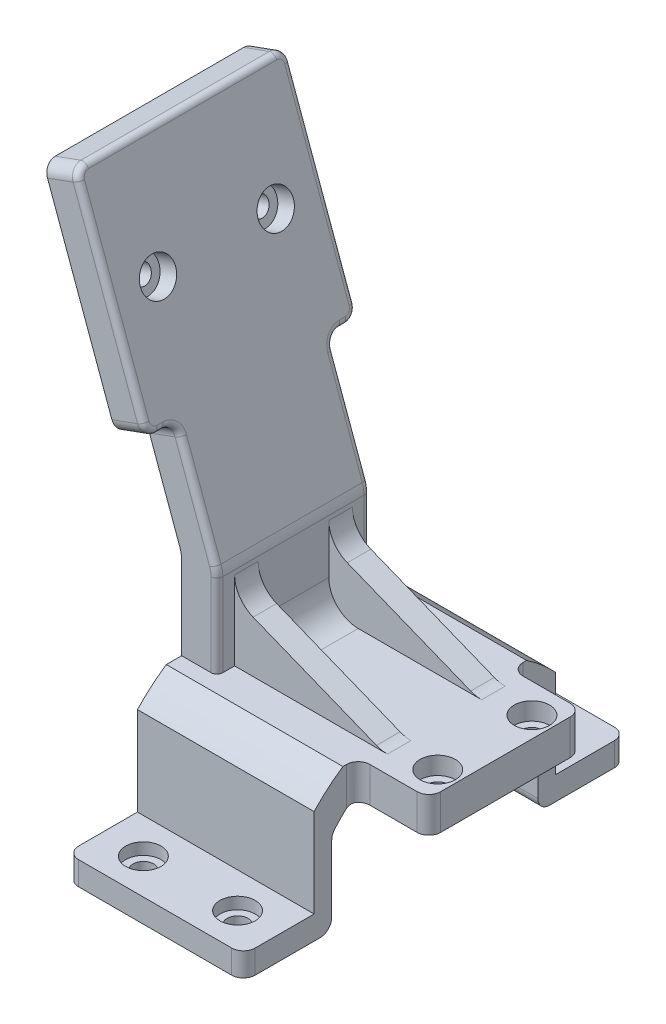
from build123d import *

# Parameters (mm, degrees)
SKETCH_1_W              = 42
SKETCH_1_H              = 26
SKETCH_1_R              = 1.7
EXTRUDE_1_DEPTH         = 6
SKETCH_15_W             = 6
SKETCH_15_H             = 26
EXTRUDE_4_DEPTH         = 15
EXTRUDE_5_DEPTH         = 26
SKETCH_17_W             = 36
SKETCH_17_H             = 36
SKETCH_17_R             = 1.6
EXTRUDE_6_DEPTH         = 5.638155725
FILLET_3_R              = 2
SKETCH_18_R             = 3
CUT_EXTRUDE_4_DEPTH     = 3
SKETCH_19_R             = 3
CUT_EXTRUDE_5_DEPTH     = 3
FILLET_4_R              = 1
FILLET_6_R              = 5
EXTRUDE_7_DEPTH         = 2
FILLET_7_R              = 5
FILLET_8_R              = 5
SKETCH_21_W             = 30
SKETCH_21_H             = 7.5
EXTRUDE_8_DEPTH         = 6
SKETCH_23_W             = 30
SKETCH_23_H             = 3
EXTRUDE_9_DEPTH         = 17.25
SKETCH_24_W             = 30
SKETCH_24_H             = 4
EXTRUDE_10_DEPTH        = 12
EXTRUDE_11_DEPTH        = 30
FILLET_9_R              = 2
CUT_EXTRUDE_6_DEPTH     = 38
FILLET_11_R             = 2
SKETCH_29_R             = 1.75
CUT_EXTRUDE_7_DEPTH     = 38
SKETCH_30_R             = 3
CUT_EXTRUDE_8_DEPTH     = 2
FILLET_9_OF_MIRROR_2_R  = 2
FILLET_11_OF_MIRROR_2_R = 2
FILLET_14_R             = 2


with BuildPart() as part:
    # 草图1 → 凸台-拉伸1 (new body)
    with BuildSketch(Plane(origin=(0, 0, 0), x_dir=(1, 0, 0), z_dir=(0, 1, 0))):
        Rectangle(SKETCH_1_W, SKETCH_1_H)
        with Locations(Location((17.5, 8, 0), (0, 0, 270))):
            Circle(SKETCH_1_R, mode=Mode.SUBTRACT)
        with Locations(Location((17.5, -8, 0), (0, 0, 90))):
            Circle(SKETCH_1_R, mode=Mode.SUBTRACT)
    extrude(amount=EXTRUDE_1_DEPTH)

    # 草图15 → 凸台-拉伸4 (add)
    with BuildSketch(Plane(origin=(0, 6, 0), x_dir=(1, 0, 0), z_dir=(0, 1, 0))):
        with Locations((-18, 0)):
            Rectangle(SKETCH_15_W, SKETCH_15_H)
    extrude(amount=EXTRUDE_4_DEPTH)

    # 草图16 → 凸台-拉伸5 (add)
    with BuildSketch(Plane.XY.offset(13)):
        Polygon((-15, 21), (-21.858229251, 39.842830003), (-27.15636258, 37.914467174), (-21, 21), align=None)
    extrude(amount=-EXTRUDE_5_DEPTH)

    # 草图17 → 凸台-拉伸6 (add)
    with BuildSketch(Plane(origin=(-11.794196751, -4.292736554, 0), x_dir=(0, 0, 1), z_dir=(-0.9396926207859104, -0.3420201433256632, 0))):
        with Locations((0, 62.915968046)):
            Rectangle(SKETCH_17_W, SKETCH_17_H)
        with Locations(Location((10, 62.915968046, 0), (0, 0, 270))):
            Circle(SKETCH_17_R, mode=Mode.SUBTRACT)
        with Locations(Location((-10, 62.915968046, 0), (0, 0, 90))):
            Circle(SKETCH_17_R, mode=Mode.SUBTRACT)
    extrude(amount=-EXTRUDE_6_DEPTH)

    # 圆角3
    fillet_3_edges = [part.edges().sort_by_distance(p)[0] for p in [
        (-24.507295915, 38.878648589, 13),
        (-24.507295915, 38.878648589, -13),
        (-24.507295915, 38.878648589, 18),
        (-36.820021075, 72.707582937, 18),
        (-24.507295915, 38.878648589, -18),
        (-36.820021075, 72.707582937, -18),
    ]]
    fillet(fillet_3_edges, radius=FILLET_3_R)

    # 草图18 → 切除-拉伸4 (cut)
    with BuildSketch(Plane(origin=(-6.496063422, -2.364373725, 0), x_dir=(0, 0, -1), z_dir=(0.9396926207859105, 0.34202014332566305, 0))):
        with Locations(Location((-10, 62.915968046, 0), (0, 0, 90))):
            Circle(SKETCH_18_R)
        with Locations(Location((10, 62.915968046, 0), (0, 0, 90))):
            Circle(SKETCH_18_R)
    extrude(amount=-CUT_EXTRUDE_4_DEPTH, mode=Mode.SUBTRACT)

    # 草图19 → 切除-拉伸5 (cut)
    with BuildSketch(Plane(origin=(0, 6, 0), x_dir=(1, 0, 0), z_dir=(0, 1, 0))):
        with Locations(Location((17.5, 8, 0), (0, 0, 270))):
            Circle(SKETCH_19_R)
        with Locations(Location((17.5, -8, 0), (0, 0, 270))):
            Circle(SKETCH_19_R)
    extrude(amount=-CUT_EXTRUDE_5_DEPTH, mode=Mode.SUBTRACT)

    # 圆角4
    fillet_4_edges = [part.edges().sort_by_distance(p)[0] for p in [
        (-15, 13.5, 13),
        (-15, 13.5, -13),
        (-18.087094482, 29.481722381, 13),
        (-18.087094482, 29.481722381, -13),
        (-21.85822925, 39.842830003, -15.5),
        (-21.85822925, 39.842830003, 15.5),
        (-28.01459183, 56.757297177, 18),
        (-34.17095441, 73.671764352, 0),
        (-28.01459183, 56.757297177, -18),
        (-33.970603649, 73.121305159, -17.414213562),
        (-22.058580012, 40.393289196, -17.414213562),
        (-22.058580012, 40.393289196, 17.414213562),
        (-33.970603649, 73.121305159, 17.414213562),
        (-21.657878489, 39.292370811, -13.585786438),
        (-21.657878489, 39.292370811, 13.585786438),
    ]]
    fillet(fillet_4_edges, radius=FILLET_4_R)

    # 圆角6
    # the kernel refuses this fillet: 5 mm, written as the material it adds along each edge
    with BuildSketch(Plane(origin=(-21, 21, 13), x_dir=(0, -1, 0), z_dir=(0, 0, -1))) as fillet_6_piece_1:
        with BuildLine():
            CenterArc((FILLET_6_R * 0.176326980708, FILLET_6_R), FILLET_6_R, 250, 20)
            Line((-FILLET_6_R * 0.165693162617, FILLET_6_R * 0.0603073792141), (0, 0))
            Line((0, 0), (FILLET_6_R * 0.176326980708, 0))
        make_face()
    extrude(amount=26)
    # the kernel refuses this fillet: 5 mm, written as the material it takes off along each edge
    with BuildSketch(Plane(origin=(-20, 20.118365097, -13), x_dir=(0.9396926207859104, 0.3420201433256632, 0), z_dir=(-0.3420201433256632, 0.9396926207859104, 0))) as fillet_6_2_piece_1:
        with BuildLine():
            CenterArc((4, -1), 1, 0, 90)
            Line((5, -1), (5, 0))
            Line((5, 0), (4, 0))
        make_face()
    revolve(axis=Axis((-20, 20.118365097, -13), (0, 0, -1)), revolution_arc=20, mode=Mode.SUBTRACT)
    with BuildSketch(Plane(origin=(-20, 20.118365097, 13), x_dir=(1, 0, 0), z_dir=(0, -1, 0))) as fillet_6_2_piece_2:
        with BuildLine():
            CenterArc((4, -1), 1, 0, 90)
            Line((5, -1), (5, 0))
            Line((5, 0), (4, 0))
        make_face()
    revolve(axis=Axis((-20, 20.118365097, 13), (0, 0, 1)), revolution_arc=20, mode=Mode.SUBTRACT)
    with BuildSketch(Plane(origin=(-15, 21.000000001, -13), x_dir=(-0.34202014332566494, 0.9396926207859098, 0), z_dir=(0, 0, 1))) as fillet_6_2_piece_3:
        with BuildLine():
            CenterArc((FILLET_6_R * 0.176326980708, FILLET_6_R), FILLET_6_R, 250, 20)
            Line((-FILLET_6_R * 0.165693162617, FILLET_6_R * 0.0603073792141), (0, 0))
            Line((0, 0), (FILLET_6_R * 0.176326980708, 0))
        make_face()
    extrude(amount=26, mode=Mode.SUBTRACT)

    # 草图20 → 凸台-拉伸7 (add, symmetric)
    with BuildSketch(Plane.XY.offset(8)):
        Polygon((-15, 16), (10, 6), (-15, 6), align=None)
    extrude_7 = extrude(amount=EXTRUDE_7_DEPTH, both=True)

    # 镜向1: 凸台-拉伸7 across plane
    add(extrude_7.mirror(Plane(origin=(0, 0, 0), x_dir=(1, 0, 0), z_dir=(0, 0, -1))))

    # 圆角7
    fillet_7_edges = [part.edges().sort_by_distance(p)[0] for p in [
        (-15, 16, 8),
        (10, 6, 8),
        (-15, 16, -8),
        (10, 6, -8),
    ]]
    fillet(fillet_7_edges, radius=FILLET_7_R)

    # 圆角8
    fillet_8_edges = [part.edges().sort_by_distance(p)[0] for p in [
        (-15, 6, 0),
    ]]
    fillet(fillet_8_edges, radius=FILLET_8_R)

    # 草图21 → 凸台-拉伸8 (add)
    with BuildSketch(Plane(origin=(0, 6, 0), x_dir=(1, 0, 0), z_dir=(0, 1, 0))):
        with Locations((-6, -16.75)):
            Rectangle(SKETCH_21_W, SKETCH_21_H)
    extrude_8 = extrude(amount=-EXTRUDE_8_DEPTH)

    # 草图23 → 凸台-拉伸9 (add)
    with BuildSketch(Plane.XZ):
        with Locations((-6, 19)):
            Rectangle(SKETCH_23_W, SKETCH_23_H)
    extrude_9 = extrude(amount=EXTRUDE_9_DEPTH)

    # 草图24 → 凸台-拉伸10 (add)
    with BuildSketch(Plane.XY.offset(20.5)):
        with Locations((-6, -15.25)):
            Rectangle(SKETCH_24_W, SKETCH_24_H)
    extrude_10 = extrude(amount=EXTRUDE_10_DEPTH)

    # 草图26 → 凸台-拉伸11 (add)
    with BuildSketch(Plane.ZY.offset(21)):
        with BuildLine():
            Line((17.5, -3.107864376), (17.5, 0))
            Line((17.5, 0), (14.446020213, 0))
            ThreePointArc((14.446020213, 0), (16.048419147, -1.4798306), (17.5, -3.107864376))
        make_face()
    extrude_11 = extrude(amount=-EXTRUDE_11_DEPTH)

    # 圆角9
    fillet_9_edges = [part.edges().sort_by_distance(p)[0] for p in [
        (-6, -3.107864376, 17.5),
        (-6, 0, 14.446020213),
    ]]
    fillet(fillet_9_edges, radius=FILLET_9_R)

    # 草图28 → 切除-拉伸6 (cut)
    with BuildSketch(Plane.ZY.offset(21)):
        with BuildLine():
            Line((20.5, 1.822231123), (20.5, 6))
            Line((20.5, 6), (15.602483777, 6))
            ThreePointArc((15.602483777, 6), (18.171702504, 4.052329171), (20.5, 1.822231123))
        make_face()
    cut_extrude_6 = extrude(amount=-CUT_EXTRUDE_6_DEPTH, mode=Mode.SUBTRACT)

    # 圆角11
    fillet_11_edges = [part.edges().sort_by_distance(p)[0] for p in [
        (-6, -17.25, 17.5),
        (-21, -15.25, 32.5),
        (9, -15.25, 32.5),
    ]]
    fillet(fillet_11_edges, radius=FILLET_11_R)

    # 草图29 → 切除-拉伸7 (cut)
    with BuildSketch(Plane(origin=(0, -13.25, 0), x_dir=(1, 0, 0), z_dir=(0, 1, 0))):
        with Locations(Location((2, -26.5, 0), (0, 0, 270))):
            Circle(SKETCH_29_R)
        with Locations(Location((-14, -26.5, 0), (0, 0, 270))):
            Circle(SKETCH_29_R)
    cut_extrude_7 = extrude(amount=-CUT_EXTRUDE_7_DEPTH, mode=Mode.SUBTRACT)

    # 草图30 → 切除-拉伸8 (cut)
    with BuildSketch(Plane(origin=(0, -13.25, 0), x_dir=(1, 0, 0), z_dir=(0, 1, 0))):
        with Locations(Location((2, -26.5, 0), (0, 0, 270))):
            Circle(SKETCH_30_R)
        with Locations(Location((-14, -26.5, 0), (0, 0, 270))):
            Circle(SKETCH_30_R)
    cut_extrude_8 = extrude(amount=-CUT_EXTRUDE_8_DEPTH, mode=Mode.SUBTRACT)

    # 镜向2: 凸台-拉伸8, 凸台-拉伸9, 凸台-拉伸10, 凸台-拉伸11, 切除-拉伸6, 切除-拉伸7, 切除-拉伸8 across plane
    add(extrude_8.mirror(Plane.XY))
    add(extrude_9.mirror(Plane.XY))
    add(extrude_10.mirror(Plane.XY))
    add(extrude_11.mirror(Plane.XY))
    add(cut_extrude_6.mirror(Plane.XY), mode=Mode.SUBTRACT)
    add(cut_extrude_7.mirror(Plane.XY), mode=Mode.SUBTRACT)
    add(cut_extrude_8.mirror(Plane.XY), mode=Mode.SUBTRACT)

    # 圆角9 of 镜向2
    fillet_9_of_mirror_2_edges = [part.edges().sort_by_distance(p)[0] for p in [
        (-6, -3.107864376, -17.5),
        (-6, 0, -14.446020213),
    ]]
    fillet(fillet_9_of_mirror_2_edges, radius=FILLET_9_OF_MIRROR_2_R)

    # 圆角11 of 镜向2
    fillet_11_of_mirror_2_edges = [part.edges().sort_by_distance(p)[0] for p in [
        (-6, -17.25, -17.5),
        (-21, -15.25, -32.5),
        (9, -15.25, -32.5),
    ]]
    fillet(fillet_11_of_mirror_2_edges, radius=FILLET_11_OF_MIRROR_2_R)

    # 圆角14
    fillet_14_edges = [part.edges().sort_by_distance(p)[0] for p in [
        (9, 3, 13),
        (9, 3, -13),
        (21, 3, 13),
        (21, 3, -13),
    ]]
    fillet(fillet_14_edges, radius=FILLET_14_R)


solid = part.part
